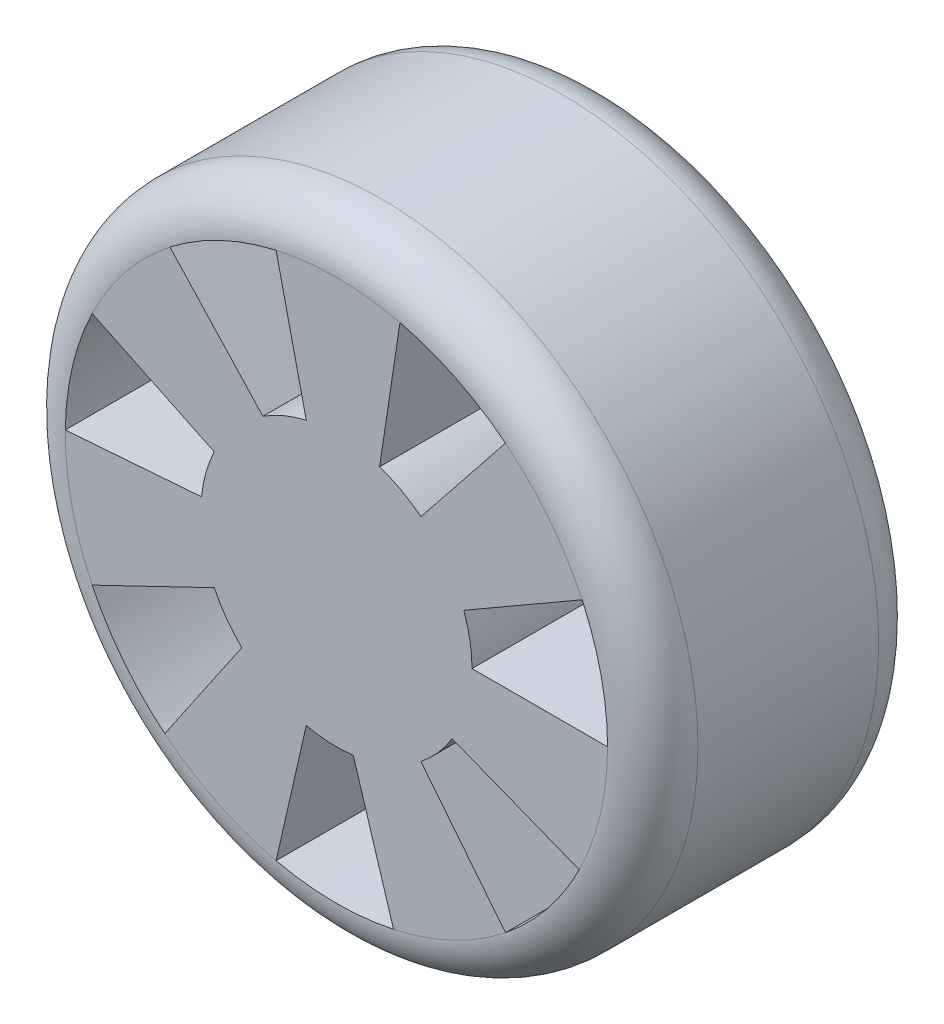
from build123d import *

# Parameters (mm, degrees)
SKETCH1_R           = 88.9
BOSS_EXTRUDE1_DEPTH = 76.2
CUT_EXTRUDE1_REACH  = 149.013


with BuildPart() as part:
    # Sketch1 → Boss-Extrude1 (new body)
    with BuildSketch(Plane.XY):
        with Locations(Location((0, 0, 0), (0, 0, 180))):
            Circle(SKETCH1_R)
    extrude(amount=BOSS_EXTRUDE1_DEPTH)

    # Sketch3 → Cut-Extrude1 (cut, up to next)
    with BuildSketch(Plane.XY.offset(76.2), mode=Mode.PRIVATE) as cut_extrude1_sk1:
        with BuildLine():
            Line((35.802288852, 13.030967461), (69.049928483, 32.226501152))
            ThreePointArc((69.049928483, 32.226501152), (74.391009371, 16.505081787), (76.2, 0))
            Line((76.2, 0), (38.1, 0))
            ThreePointArc((38.1, 0), (37.52117539, 6.615995569), (35.802288852, 13.030967461))
        make_face()
    cut_extrude1_tool1 = extrude(cut_extrude1_sk1.sketch, amount=-CUT_EXTRUDE1_REACH, mode=Mode.PRIVATE) & part.part
    # Sketch3 → Cut-Extrude1 (cut, up to next)
    with BuildSketch(Plane.XY.offset(76.2), mode=Mode.PRIVATE) as cut_extrude1_sk2:
        with BuildLine():
            Line((32.51038259, -19.866681249), (68.247619398, -33.892513133))
            ThreePointArc((68.247619398, -33.892513133), (59.286228254, -47.870482966), (47.509922902, -59.575558964))
            Line((47.509922902, -59.575558964), (23.754961451, -29.787779482))
            ThreePointArc((23.754961451, -29.787779482), (28.566663833, -25.210230412), (32.51038259, -19.866681249))
        make_face()
    cut_extrude1_tool2 = extrude(cut_extrude1_sk2.sketch, amount=-CUT_EXTRUDE1_REACH, mode=Mode.PRIVATE) & part.part
    # Sketch3 → Cut-Extrude1 (cut, up to next)
    with BuildSketch(Plane.XY.offset(76.2), mode=Mode.PRIVATE) as cut_extrude1_sk3:
        with BuildLine():
            Line((4.737495147, -37.804313771), (16.053460909, -74.489773747))
            ThreePointArc((16.053460909, -74.489773747), (-0.462291956, -76.198597665), (-16.956095167, -74.289506908))
            Line((-16.956095167, -74.289506908), (-8.478047584, -37.144753454))
            ThreePointArc((-8.478047584, -37.144753454), (-1.899128244, -38.052638698), (4.737495147, -37.804313771))
        make_face()
    cut_extrude1_tool3 = extrude(cut_extrude1_sk3.sketch, amount=-CUT_EXTRUDE1_REACH, mode=Mode.PRIVATE) & part.part
    # Sketch3 → Cut-Extrude1 (cut, up to next)
    with BuildSketch(Plane.XY.offset(76.2), mode=Mode.PRIVATE) as cut_extrude1_sk4:
        with BuildLine():
            Line((-26.602822769, -27.274526957), (-48.229281076, -58.994715415))
            ThreePointArc((-48.229281076, -58.994715415), (-59.862696895, -47.147614155), (-68.653827734, -33.061940921))
            Line((-68.653827734, -33.061940921), (-34.326913867, -16.53097046))
            ThreePointArc((-34.326913867, -16.53097046), (-30.934838018, -22.240633912), (-26.602822769, -27.274526957))
        make_face()
    cut_extrude1_tool4 = extrude(cut_extrude1_sk4.sketch, amount=-CUT_EXTRUDE1_REACH, mode=Mode.PRIVATE) & part.part
    # Sketch3 → Cut-Extrude1 (cut, up to next)
    with BuildSketch(Plane.XY.offset(76.2), mode=Mode.PRIVATE) as cut_extrude1_sk5:
        with BuildLine():
            Line((-37.910672541, 3.793534955), (-76.194390713, 0.924566897))
            ThreePointArc((-76.194390713, 0.924566897), (-74.185270095, 17.40648445), (-68.653827734, 33.061940921))
            Line((-68.653827734, 33.061940921), (-34.326913867, 16.53097046))
            ThreePointArc((-34.326913867, 16.53097046), (-36.675983809, 10.319021836), (-37.910672541, 3.793534955))
        make_face()
    cut_extrude1_tool5 = extrude(cut_extrude1_sk5.sketch, amount=-CUT_EXTRUDE1_REACH, mode=Mode.PRIVATE) & part.part
    # Sketch3 → Cut-Extrude1 (cut, up to next)
    with BuildSketch(Plane.XY.offset(76.2), mode=Mode.PRIVATE) as cut_extrude1_sk6:
        with BuildLine():
            Line((-20.671012653, 32.004987672), (-46.78357006, 60.147631478))
            ThreePointArc((-46.78357006, 60.147631478), (-32.64482181, 68.853145237), (-16.956095167, 74.289506908))
            Line((-16.956095167, 74.289506908), (-8.478047584, 37.144753454))
            ThreePointArc((-8.478047584, 37.144753454), (-14.799365738, 35.108243672), (-20.671012653, 32.004987672))
        make_face()
    cut_extrude1_tool6 = extrude(cut_extrude1_sk6.sketch, amount=-CUT_EXTRUDE1_REACH, mode=Mode.PRIVATE) & part.part
    # Sketch3 → Cut-Extrude1 (cut, up to next)
    with BuildSketch(Plane.XY.offset(76.2), mode=Mode.PRIVATE) as cut_extrude1_sk7:
        with BuildLine():
            Line((12.134341375, 36.116031889), (17.856233058, 74.078302768))
            ThreePointArc((17.856233058, 74.078302768), (33.477843131, 68.451983312), (47.509922902, 59.575558964))
            Line((47.509922902, 59.575558964), (23.754961451, 29.787779482))
            ThreePointArc((23.754961451, 29.787779482), (18.221476585, 33.460241945), (12.134341375, 36.116031889))
        make_face()
    cut_extrude1_tool7 = extrude(cut_extrude1_sk7.sketch, amount=-CUT_EXTRUDE1_REACH, mode=Mode.PRIVATE) & part.part
    add(cut_extrude1_tool1.solids().sort_by_distance((58.182027, 12.183187, 76.2))[0], mode=Mode.SUBTRACT)
    add(cut_extrude1_tool2.solids().sort_by_distance((45.8011, -37.892448, 76.2))[0], mode=Mode.SUBTRACT)
    add(cut_extrude1_tool3.solids().sort_by_distance((-1.06899, -59.434296, 76.2))[0], mode=Mode.SUBTRACT)
    add(cut_extrude1_tool4.solids().sort_by_distance((-47.134109, -36.220908, 76.2))[0], mode=Mode.SUBTRACT)
    add(cut_extrude1_tool5.solids().sort_by_distance((-57.706282, 14.267563, 76.2))[0], mode=Mode.SUBTRACT)
    add(cut_extrude1_tool6.solids().sort_by_distance((-24.824448, 54.012268, 76.2))[0], mode=Mode.SUBTRACT)
    add(cut_extrude1_tool7.solids().sort_by_distance((26.750702, 53.084633, 76.2))[0], mode=Mode.SUBTRACT)

    # Fillet2: read off the stored shape, not the designer's step
    # Fillet2 outline → Fillet2 (revolve, cut)
    with BuildSketch(Plane.XZ):
        with BuildLine():
            ThreePointArc((76.2, 76.2), (85.180256121, 72.480256121), (88.9, 63.5))
            Line((88.9, 63.5), (88.9, 76.2))
            Line((88.9, 76.2), (76.2, 76.2))
        make_face()
        with BuildLine():
            Line((88.9, 0), (88.9, 12.7))
            ThreePointArc((88.9, 12.7), (85.180256121, 3.719743879), (76.2, 0))
            Line((76.2, 0), (88.9, 0))
        make_face()
    revolve(axis=Axis((0, 0, 0), (0, 0, 1)), mode=Mode.SUBTRACT)


solid = part.part
